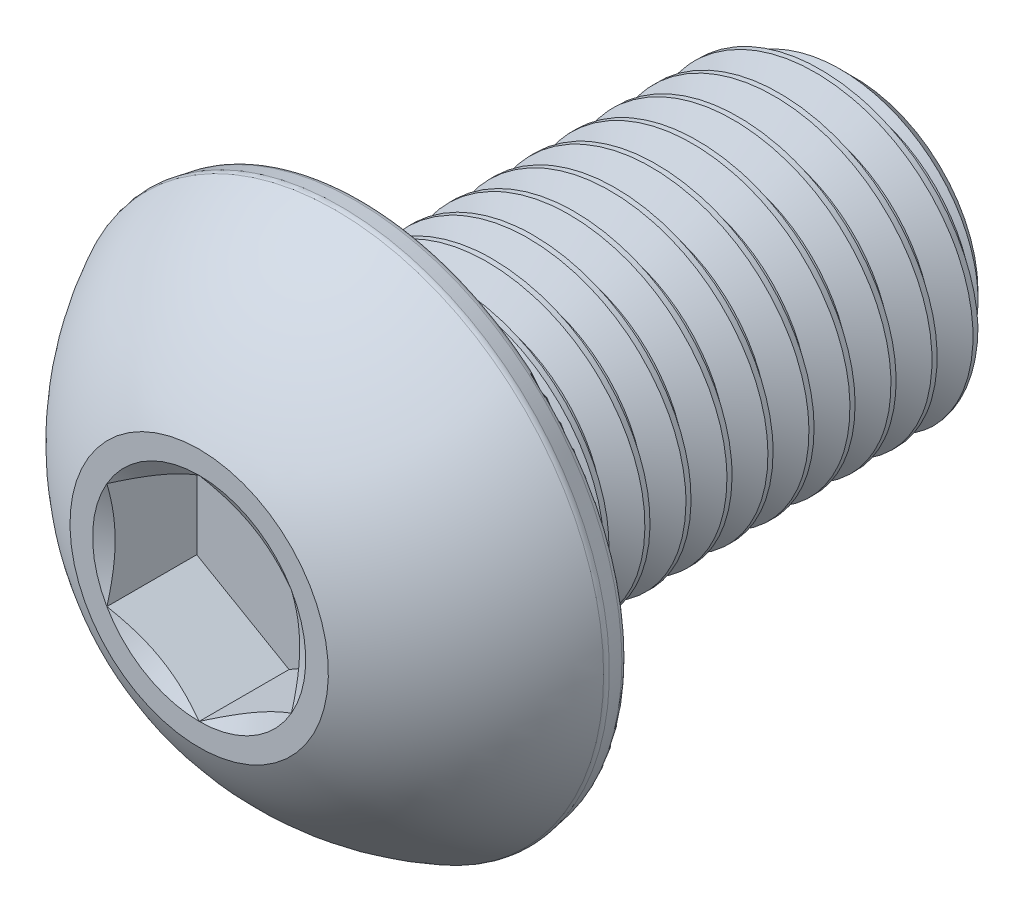
from build123d import *

# Parameters (mm, degrees)
CUT_EXTRUDE1_DEPTH = 2.31902
FILLET1_R          = 0.21082
CUT_SWEEP1_PITCH   = 1.058333333
CUT_SWEEP1_TO      = 12.7


with BuildPart() as part:
    # Sketch3 → Revolve1 (revolve)
    with BuildSketch(Plane(origin=(0, 0, 0), x_dir=(0, 0, -1), z_dir=(1, 0, 0)), mode=Mode.PRIVATE) as revolve1_sk:
        with BuildLine():
            Line((-8.4582, 0), (-8.4582, 3.33375))
            ThreePointArc((-8.4582, 3.33375), (-6.972098684, 5.443720932), (-4.87426, 6.9469))
            Line((-4.87426, 6.9469), (-4.2418, 6.835380238))
            Line((-4.2418, 6.835380238), (-4.2418, 3.9751))
            Line((-4.2418, 3.9751), (7.66445, 3.9751))
            Line((7.66445, 3.9751), (8.4582, 3.18135))
            Line((8.4582, 3.18135), (8.4582, 0))
            Line((8.4582, 0), (-8.4582, 0))
        make_face()
    revolve(revolve1_sk.sketch.rotate(Axis((0, 0, 8.4582), (0, 0, -1)), 90), axis=Axis((0, 0, 8.4582), (0, 0, -1)))

    # Sketch4 → Cut-Extrude1 (cut)
    with BuildSketch(Plane.XY.offset(8.4582)):
        Polygon((-2.38125, -1.374815329), (0, -2.749630657), (2.38125, -1.374815329), (2.38125, 1.374815329), (0, 2.749630657), (-2.38125, 1.374815329), align=None)
    extrude(amount=-CUT_EXTRUDE1_DEPTH, mode=Mode.SUBTRACT)

    # Cut-Extrude2 cone 1 section (through the dimple's axis) → Cut-Extrude2 (revolve, cut)
    with BuildSketch(Plane(origin=(0, 0, 8.4582), x_dir=(0, -1, 0), z_dir=(1, 0, 0))):
        Polygon((0, 0), (2.749630657, 0), (0, 1.5875), align=None)
    revolve(axis=Axis((0, 0, 8.4582), (0, 0, -1)), mode=Mode.SUBTRACT)

    # Fillet1
    fillet1_edges = [part.edges().sort_by_distance(p)[0] for p in [
        (-6.835380238, 0, 4.2418),
        (-6.9469, 0, 4.87426),
    ]]
    fillet(fillet1_edges, radius=FILLET1_R)


with BuildPart() as body_2:
    # Split1: read off the stored shape, not the designer's step
    # Split1: the piece on the far side of the plane
    add(part.part)
    split(bisect_by=Plane.XY.offset(4.2418), keep=Keep.BOTTOM)

    # Cut-Sweep1: arcs per turn and ends read off the stored shape
    # Cut-Sweep1: the profile of Sketch7 screwed along a right-hand helix through 13 turns, 8 arcs to a turn; built about Z, then put on its axis
    cut_sweep1_z = Axis((0, 0, 0), (0, 0, 1))
    cut_sweep1_corners = [(4.032383972, 0, 0.033072917), (4.032383972, 0, -0.959114583), (3.287692336, 0, -0.529166667), (3.287692336, 0, -0.396875)]
    with BuildLine(mode=Mode.PRIVATE) as cut_sweep1_profile:
        Line(cut_sweep1_corners[0], cut_sweep1_corners[1])
        Line(cut_sweep1_corners[1], cut_sweep1_corners[2])
        Line(cut_sweep1_corners[2], cut_sweep1_corners[3])
        Line(cut_sweep1_corners[3], cut_sweep1_corners[0])
    cut_sweep1_cap = Face(cut_sweep1_profile.wire())
    cut_sweep1_turn_angles = [0, 22.5, 45, 67.5, 90, 112.5, 135, 157.5, 180, 202.5, 225, 247.5, 270, 292.5, 315, 337.5, 360]
    cut_sweep1_turn_weights = [1, 0.9238795325112867, 1, 0.9238795325112867, 1, 0.9238795325112867, 1, 0.9238795325112867, 1, 0.9238795325112867, 1, 0.9238795325112867, 1, 0.9238795325112867, 1, 0.9238795325112867, 1]
    cut_sweep1_turn_rails = [Edge.make_bspline([Vector(p[0], p[1], 0).rotate(cut_sweep1_z, cut_sweep1_turn_angles[k]) / cut_sweep1_turn_weights[k] + Vector(0, 0, p[2] + CUT_SWEEP1_PITCH * cut_sweep1_turn_angles[k] / 360) for k in range(17)], [0, 0, 0, 1, 1, 2, 2, 3, 3, 4, 4, 5, 5, 6, 6, 7, 7, 8, 8, 8], 2, cut_sweep1_turn_weights) for p in cut_sweep1_corners]
    cut_sweep1_turn_sides = [Face.make_surface_from_curves(cut_sweep1_turn_rails[p[0]], cut_sweep1_turn_rails[p[1]]) for p in [(0, 1), (1, 2), (2, 3), (3, 0)]]
    cut_sweep1 = Plane(origin=(0, 0, -8.4582), x_dir=(0, 1, 0), z_dir=(0, 0, 1)) * split(Solid(Shell([*[p.moved(Location((0, 0, CUT_SWEEP1_PITCH * i))) for i in range(13) for p in cut_sweep1_turn_sides], cut_sweep1_cap, cut_sweep1_cap.rotate(cut_sweep1_z, 4680).moved(Location((0, 0, CUT_SWEEP1_PITCH * 4680 / 360)))])), bisect_by=Plane.XY.offset(CUT_SWEEP1_TO), keep=Keep.BOTTOM, mode=Mode.PRIVATE)
    add(cut_sweep1, mode=Mode.SUBTRACT)


with BuildPart() as part_1:
    add(part.part)

    # Split1
    split(bisect_by=Plane.XY.offset(4.2418), keep=Keep.TOP)

    add(body_2.part)  # Boss-Extrude1 merges body 2
    # Boss-Extrude1: read off the stored shape, not the designer's step
    # Boss-Extrude1 outline → Boss-Extrude1 (revolve)
    with BuildSketch(Plane.XZ):
        Polygon((3.287686204, 4.2418), (3.287686204, 3.43981826), (4.089667944, 4.2418), align=None)
    revolve(axis=Axis((0, 0, 0), (0, 0, 1)))


solid = part_1.part
